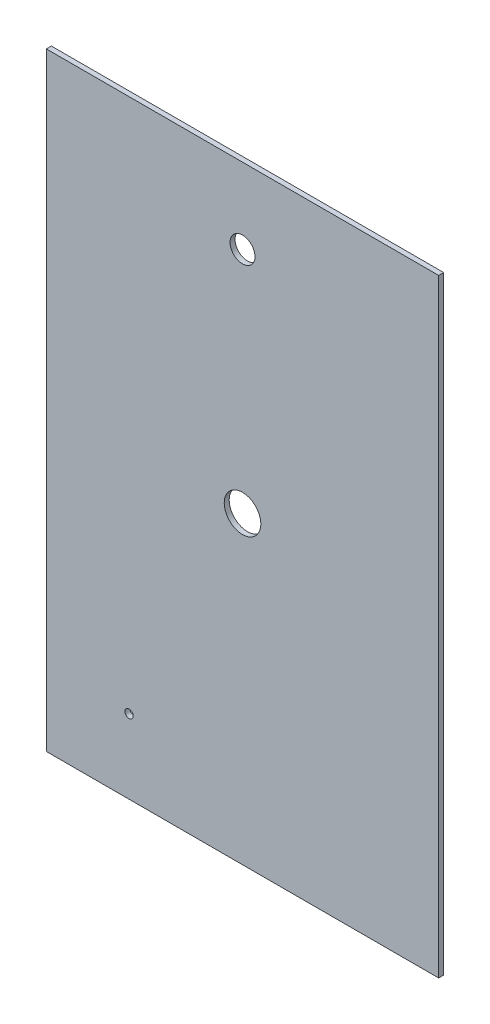
from build123d import *

# Parameters (mm, degrees)
SKETCH1_W           = 236
SKETCH1_H           = 366
BOSS_EXTRUDE1_DEPTH = 3
CUT_EXTRUDE2_REACH  = 219.766
SKETCH2_R           = 7.5
CUT_EXTRUDE5_REACH  = 219.766
SKETCH4_R           = 11
SKETCH5_R           = 2.5
CUT_EXTRUDE7_DEPTH  = 5


with BuildPart() as part:
    # Sketch1 → Boss-Extrude1 (new body)
    with BuildSketch(Plane.XY):
        Rectangle(SKETCH1_W, SKETCH1_H)
    extrude(amount=BOSS_EXTRUDE1_DEPTH)

    # Sketch2 → Cut-Extrude2 (cut, up to next)
    with BuildSketch(Plane(origin=(0, 0, 0), x_dir=(-1, 0, 0), z_dir=(0, 0, -1)), mode=Mode.PRIVATE) as cut_extrude2_sk1:
        with Locations((0, 137.5)):
            Circle(SKETCH2_R)
    cut_extrude2_tool1 = extrude(cut_extrude2_sk1.sketch, amount=-CUT_EXTRUDE2_REACH, mode=Mode.PRIVATE) & part.part
    add(cut_extrude2_tool1.solids().sort_by_distance((0, 137.5, 0))[0], mode=Mode.SUBTRACT)

    # Sketch4 → Cut-Extrude5 (cut, up to next)
    with BuildSketch(Plane.XY, mode=Mode.PRIVATE) as cut_extrude5_sk1:
        Circle(SKETCH4_R)
    cut_extrude5_tool1 = extrude(cut_extrude5_sk1.sketch, amount=CUT_EXTRUDE5_REACH, mode=Mode.PRIVATE) & part.part
    add(cut_extrude5_tool1.solids().sort_by_distance((0, 0, 0))[0], mode=Mode.SUBTRACT)

    # Sketch5 → Cut-Extrude7 (cut)
    with BuildSketch(Plane(origin=(0, 0, 0), x_dir=(-1, 0, 0), z_dir=(0, 0, -1))):
        with Locations((68.224111315, -138.471071027)):
            Circle(SKETCH5_R)
    extrude(amount=-CUT_EXTRUDE7_DEPTH, mode=Mode.SUBTRACT)


solid = part.part
